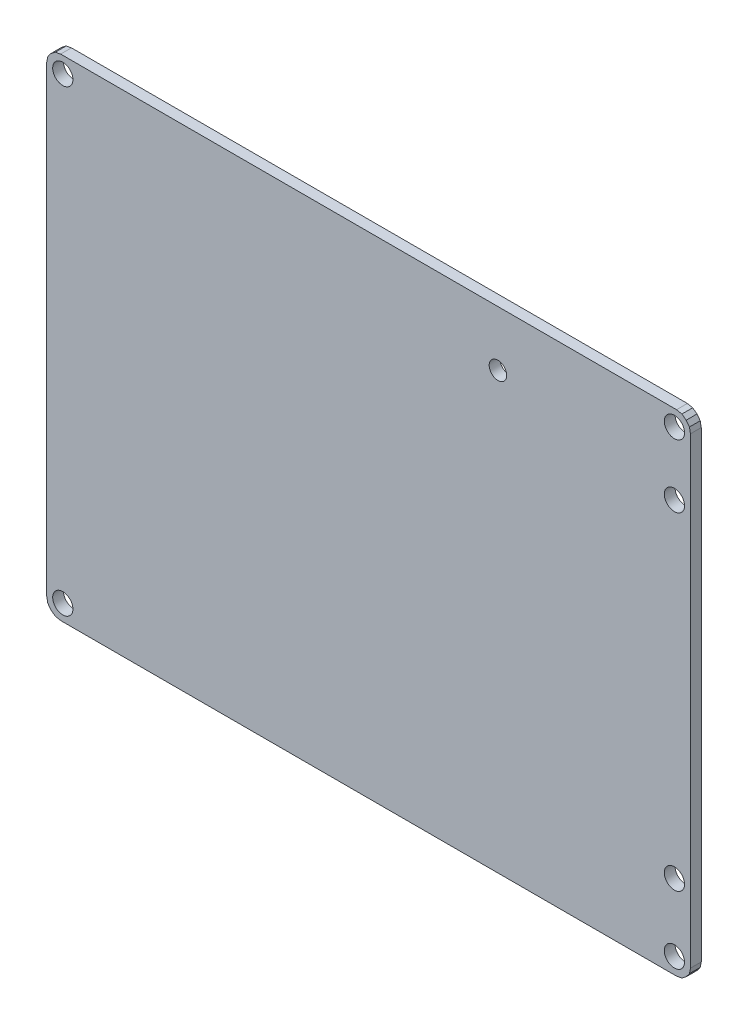
from build123d import *

# Parameters (mm, degrees)
SKETCH_1_R      = 1.3
SKETCH_1_R_2    = 1.5
EXTRUDE_1_DEPTH = 1.6


with BuildPart() as part:
    # Эскиз1 → Бобышка-Вытянуть1 (new body)
    with BuildSketch(Plane.XY):
        Polygon((-45.640633333, 36.353733333), (45.640633333, 36.353733333), (46.434366667, 36.195), (47.069366667, 35.718733333), (47.545633333, 35.083733333), (47.704366667, 34.29), (47.704366667, -34.29), (47.545633333, -35.083733333), (47.069366667, -35.718733333), (46.434366667, -36.195), (45.640633333, -36.353733333), (-45.640633333, -36.353733333), (-46.434366667, -36.195), (-47.069366667, -35.718733333), (-47.545633333, -35.083733333), (-47.704366667, -34.29), (-47.704366667, 34.29), (-47.545633333, 35.083733333), (-47.069366667, 35.718733333), (-46.434366667, 36.195), align=None)
        with Locations((19.169366667, 28.165)):
            Circle(SKETCH_1_R, mode=Mode.SUBTRACT)
        with Locations((45.323133333, 24.606266667)):
            Circle(SKETCH_1_R_2, mode=Mode.SUBTRACT)
        with Locations((45.3231, 33.9725)):
            Circle(SKETCH_1_R_2, mode=Mode.SUBTRACT)
        with Locations((-45.322866667, 33.972733333)):
            Circle(SKETCH_1_R_2, mode=Mode.SUBTRACT)
        with Locations((-45.323133333, -33.9725)):
            Circle(SKETCH_1_R_2, mode=Mode.SUBTRACT)
        with Locations((45.3231, -33.9725)):
            Circle(SKETCH_1_R_2, mode=Mode.SUBTRACT)
        with Locations((45.3231, -23.971266667)):
            Circle(SKETCH_1_R_2, mode=Mode.SUBTRACT)
    extrude(amount=EXTRUDE_1_DEPTH)


solid = part.part
